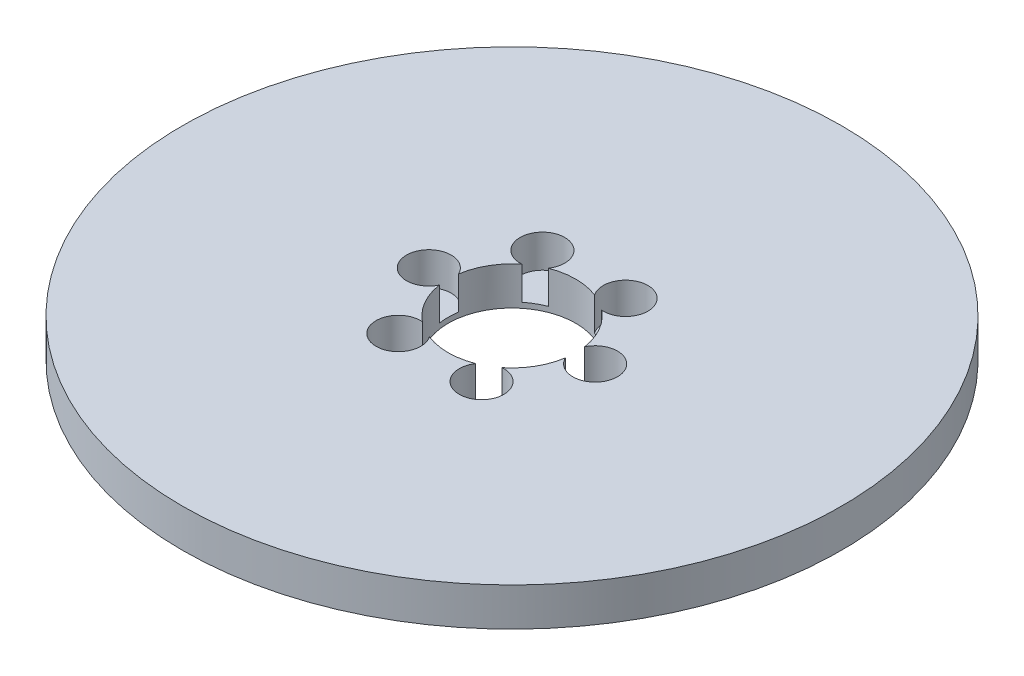
from build123d import *

# Parameters (mm, degrees)
SKETCH1_R           = 77.5
BOSS_EXTRUDE1_DEPTH = 9
SKETCH2_R           = 15
CUT_EXTRUDE1_DEPTH  = 110.970450577
SKETCH3_R           = 5.247709059
CUT_EXTRUDE2_DEPTH  = 7.759946185
CIRPATTERN1_COUNT   = 6


with BuildPart() as part:
    # Sketch1 → Boss-Extrude1 (new body)
    with BuildSketch(Plane(origin=(0, 0, 0), x_dir=(1, 0, 0), z_dir=(0, 1, 0))):
        Circle(SKETCH1_R)
    extrude(amount=BOSS_EXTRUDE1_DEPTH)

    # Sketch2 → Cut-Extrude1 (cut, through all)
    with BuildSketch(Plane(origin=(0, 0, 0), x_dir=(1, 0, 0), z_dir=(0, 1, 0))):
        Circle(SKETCH2_R)
    extrude(amount=CUT_EXTRUDE1_DEPTH, mode=Mode.SUBTRACT)

    # Sketch3 → Cut-Extrude2 (cut)
    with BuildSketch(Plane(origin=(0, 9, 0), x_dir=(1, 0, 0), z_dir=(0, 1, 0))):
        with Locations((-19.558093847, 0)):
            Circle(SKETCH3_R)
    cut_extrude2 = extrude(amount=-CUT_EXTRUDE2_DEPTH, mode=Mode.SUBTRACT)

    # CirPattern1: Cut-Extrude2 ×6 about axis
    cirpattern1_axis = Axis((0, 0, 0), (0, 1, 0))
    for i in range(1, CIRPATTERN1_COUNT):
        add(cut_extrude2.rotate(cirpattern1_axis, i * 360 / CIRPATTERN1_COUNT), mode=Mode.SUBTRACT)


solid = part.part
